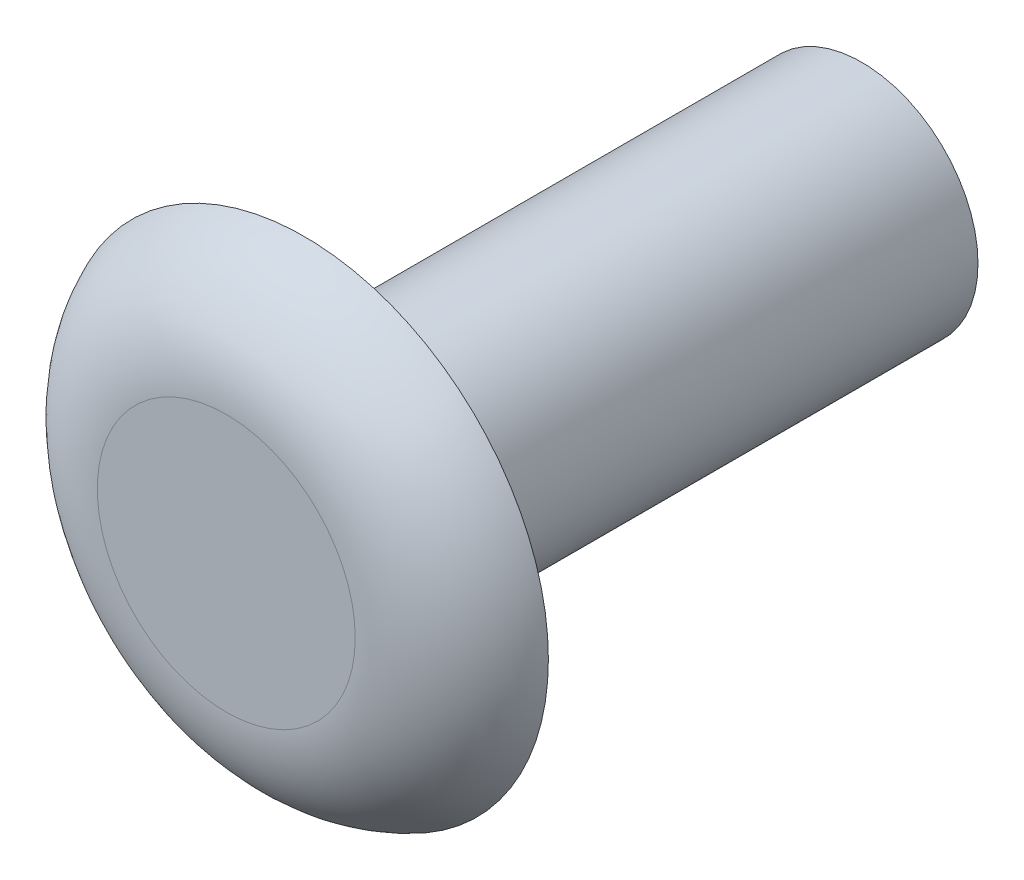
from build123d import *

# Parameters (mm, degrees)
SKETCH1_R           = 5.0038
BOSS_EXTRUDE1_DEPTH = 1.6002
SKETCH2_R           = 2.38125
BOSS_EXTRUDE2_DEPTH = 11.43
FILLET1_R           = 2.54


with BuildPart() as part:
    # Sketch1 → Boss-Extrude1 (new body)
    with BuildSketch(Plane.XY):
        Circle(SKETCH1_R)
    extrude(amount=BOSS_EXTRUDE1_DEPTH)

    # Sketch2 → Boss-Extrude2 (add)
    with BuildSketch(Plane.XY):
        Circle(SKETCH2_R)
    extrude(amount=-BOSS_EXTRUDE2_DEPTH)

    # Fillet1
    # the kernel refuses this fillet: 2.54 mm, written as the material it takes off along each edge
    with BuildSketch(Plane(origin=(0, 0, 1.6002), x_dir=(1, 0, 0), z_dir=(0, -1, 0))) as fillet1_piece_1:
        with BuildLine():
            CenterArc((2.644059345, -2.54), FILLET1_R, 21.715617283, 68.284382717)
            Line((2.644059345, 0), (2.644059345, 0.0508))
            Line((2.644059345, 0.0508), (5.0038, 0.0508))
            Line((5.0038, 0.0508), (5.0546, 0))
            ThreePointArc((5.0546, 0), (5.0546, -0.8001), (5.050994813, -1.581404))
            Line((5.050994813, -1.581404), (5.0038, -1.6002))
        make_face()
    revolve(axis=Axis((0, 0, 1.6002), (0, 0, 1)), mode=Mode.SUBTRACT)


solid = part.part
